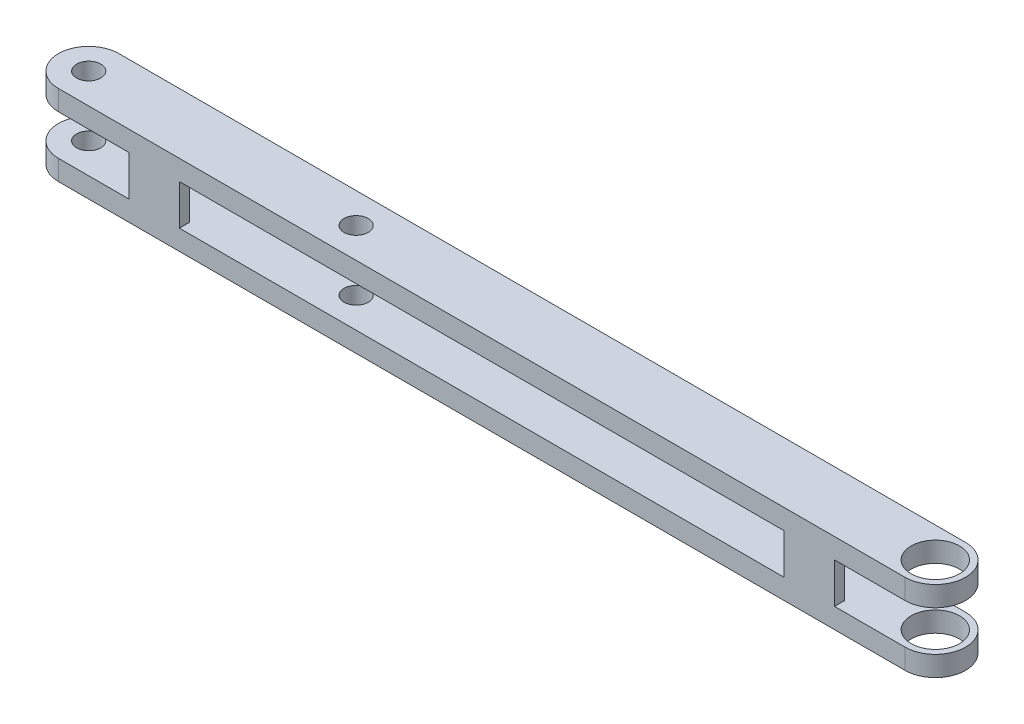
from build123d import *

# Parameters (mm, degrees)
EXTRUDE_1_DEPTH     = 20
SKETCH_2_W          = 150
SKETCH_2_H          = 10
CUT_EXTRUDE_3_DEPTH = 116.244305716
SKETCH_3_W          = 25
SKETCH_3_H          = 10
CUT_EXTRUDE_4_DEPTH = 116.244305716
SKETCH_4_W          = 10
SKETCH_4_H          = 10
CUT_EXTRUDE_5_DEPTH = 202.137390855
SKETCH_5_R          = 3
SKETCH_5_R_2        = 6
CUT_EXTRUDE_6_DEPTH = 115.509824906
SKETCH_6_R          = 3
CUT_EXTRUDE_7_DEPTH = 115.509824906


with BuildPart() as part:
    # 草图1 → 凸台-拉伸1 (new body)
    with BuildSketch(Plane(origin=(0, 0, 0), x_dir=(1, 0, 0), z_dir=(0, 1, 0))):
        with BuildLine():
            Line((-105, 7.5), (105, 7.5))
            ThreePointArc((105, 7.5), (112.5, 0), (105, -7.5))
            Line((105, -7.5), (-105, -7.5))
            ThreePointArc((-105, -7.5), (-112.5, 0), (-105, 7.5))
        make_face()
    extrude(amount=EXTRUDE_1_DEPTH)

    # 草图2 → 切除-拉伸3 (cut, through all)
    with BuildSketch(Plane(origin=(0, 0, -7.5), x_dir=(-1, 0, 0), z_dir=(0, 0, -1))):
        with Locations((0, 10)):
            Rectangle(SKETCH_2_W, SKETCH_2_H)
    extrude(amount=-CUT_EXTRUDE_3_DEPTH, mode=Mode.SUBTRACT)

    # 草图3 → 切除-拉伸4 (cut, through all)
    with BuildSketch(Plane(origin=(0, 0, -7.5), x_dir=(-1, 0, 0), z_dir=(0, 0, -1))):
        with Locations((100, 10)):
            Rectangle(SKETCH_3_W, SKETCH_3_H)
        with Locations((-100, 10)):
            Rectangle(SKETCH_3_W, SKETCH_3_H)
    extrude(amount=-CUT_EXTRUDE_4_DEPTH, mode=Mode.SUBTRACT)

    # 草图4 → 切除-拉伸5 (cut, through all)
    with BuildSketch(Plane.ZY.offset(87.5)):
        with Locations((0, 10)):
            Rectangle(SKETCH_4_W, SKETCH_4_H)
    extrude(amount=-CUT_EXTRUDE_5_DEPTH, mode=Mode.SUBTRACT)

    # 草图5 → 切除-拉伸6 (cut, through all)
    with BuildSketch(Plane(origin=(0, 20, 0), x_dir=(1, 0, 0), z_dir=(0, 1, 0))):
        with Locations((-105, 0)):
            Circle(SKETCH_5_R)
        with Locations((105, 0)):
            Circle(SKETCH_5_R_2)
    extrude(amount=-CUT_EXTRUDE_6_DEPTH, mode=Mode.SUBTRACT)

    # 草图6 → 切除-拉伸7 (cut, through all)
    with BuildSketch(Plane(origin=(0, 20, 0), x_dir=(1, 0, 0), z_dir=(0, 1, 0))):
        with Locations((-38.660679302, 0)):
            Circle(SKETCH_6_R)
    extrude(amount=-CUT_EXTRUDE_7_DEPTH, mode=Mode.SUBTRACT)


solid = part.part
